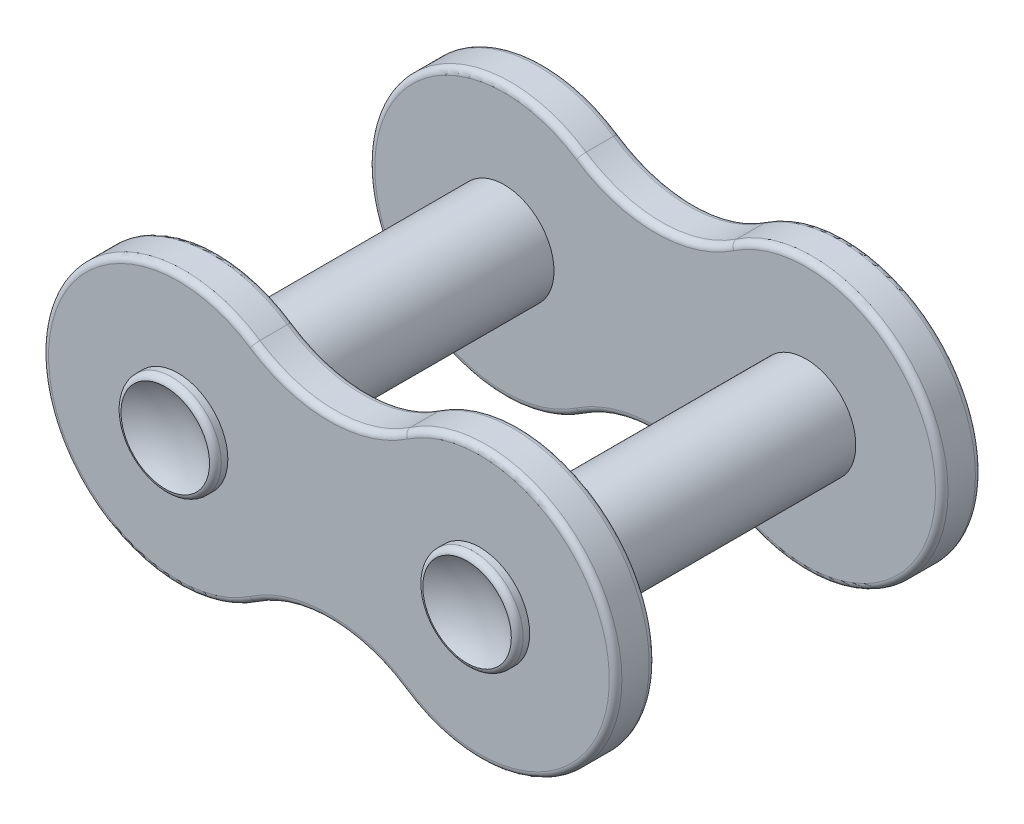
from build123d import *

# Parameters (mm, degrees)
SKETCH2_R           = 1.98
BOSS_EXTRUDE2_DEPTH = 1.5875
BOSS_EXTRUDE3_START = -0.508
SKETCH3_R           = 1.98
BOSS_EXTRUDE3_DEPTH = 15.573248
FILLET1_R           = 0.25
FILLET2_R           = 0.25


with BuildPart() as part:
    # Sketch2 → Boss-Extrude2 (new body)
    with BuildSketch(Plane.XY):
        with BuildLine():
            ThreePointArc((-2.993133713, 4.482383449), (-11.3975, 0), (-2.993133713, -4.482383449))
            ThreePointArc((-2.993133713, -4.482383449), (0, -3.571446301), (2.993133713, -4.482383449))
            ThreePointArc((2.993133713, -4.482383449), (11.3975, 0), (2.993133713, 4.482383449))
            ThreePointArc((2.993133713, 4.482383449), (0, 3.571446301), (-2.993133713, 4.482383449))
        make_face()
        with Locations((-6, 0)):
            Circle(SKETCH2_R, mode=Mode.SUBTRACT)
        with Locations(Location((6, 0, 0), (0, 0, 180))):
            Circle(SKETCH2_R, mode=Mode.SUBTRACT)
    boss_extrude2 = extrude(amount=BOSS_EXTRUDE2_DEPTH)

    # Sketch3 → Boss-Extrude3 (add)
    with BuildSketch(Plane.XY.offset(BOSS_EXTRUDE3_START)):
        with Locations((-6, 0)):
            Circle(SKETCH3_R)
    boss_extrude3 = extrude(amount=BOSS_EXTRUDE3_DEPTH)

    # Mirror1: Boss-Extrude2 across plane
    add(boss_extrude2.mirror(Plane(origin=(0, 0, 7.278624), x_dir=(1, 0, 0), z_dir=(0, 0, -1))))

    # Sketch5 → Cut-Revolve1 (revolve, cut)
    with BuildSketch(Plane(origin=(0, 0, 0), x_dir=(1, 0, 0), z_dir=(0, 1, 0)), mode=Mode.PRIVATE) as cut_revolve1_sk:
        with BuildLine():
            Line((-6, -15.319248), (-8.109882461, -15.319248))
            ThreePointArc((-8.109882461, -15.319248), (-7.12163363, -14.753585108), (-6, -14.557248))
            Line((-6, -14.557248), (-6, -15.319248))
        make_face()
    cut_revolve1 = revolve(cut_revolve1_sk.sketch.rotate(Axis((-6, 0, 14.557248), (0, 0, 1)), 180), axis=Axis((-6, 0, 14.557248), (0, 0, 1)), mode=Mode.SUBTRACT)

    # Mirror2: Cut-Revolve1 across plane
    add(cut_revolve1.mirror(Plane(origin=(0, 0, 7.278624), x_dir=(1, 0, 0), z_dir=(0, 0, -1))), mode=Mode.SUBTRACT)

    # Mirror3: Boss-Extrude3, Cut-Revolve1 across plane
    add(boss_extrude3.mirror(Plane(origin=(0, 0, 0), x_dir=(0, 0, 1), z_dir=(1, 0, 0))))
    add(cut_revolve1.mirror(Plane(origin=(0, 0, 0), x_dir=(0, 0, 1), z_dir=(1, 0, 0))), mode=Mode.SUBTRACT)

    # Mirror3 copy 1 sketch → Mirror3 copy 1 (revolve, cut)
    with BuildSketch(Plane(origin=(0, 0, 14.557248), x_dir=(-1, 0, 0), z_dir=(0, 1, 0))):
        with BuildLine():
            Line((-6, -15.319248), (-8.109882461, -15.319248))
            ThreePointArc((-8.109882461, -15.319248), (-7.12163363, -14.753585108), (-6, -14.557248))
            Line((-6, -14.557248), (-6, -15.319248))
        make_face()
    revolve(axis=Axis((6, 0, 0), (0, 0, -1)), mode=Mode.SUBTRACT)

    # Fillet1
    fillet1_edges = [part.edges().sort_by_distance(p)[0] for p in [
        (0, -3.571446301, 1.5875),
        (11.3975, 0, 1.5875),
        (0, 3.571446301, 12.969748),
        (11.3975, 0, 12.969748),
        (0, -3.571446301, 12.969748),
        (-11.3975, 0, 12.969748),
        (0, 3.571446301, 14.557248),
        (-11.3975, 0, 14.557248),
        (0, -3.571446301, 14.557248),
        (11.3975, 0, 14.557248),
        (0, 3.571446301, 1.5875),
        (11.3975, 0, 0),
        (0, -3.571446301, 0),
        (-11.3975, 0, 0),
        (0, 3.571446301, 0),
        (-11.3975, 0, 1.5875),
    ]]
    fillet(fillet1_edges, radius=FILLET1_R)

    # Fillet2
    # the kernel refuses this fillet: 0.25 mm, written as the material it takes off along each edge
    with BuildSketch(Plane(origin=(-6, 0, -0.508), x_dir=(1, 0, 0), z_dir=(0, -1, 0))) as fillet2_piece_1:
        with BuildLine():
            CenterArc((1.73, 0.248221931), FILLET2_R, 276.837537201, 83.162462799)
            Line((1.75976362, 0), (1.760358893, -0.004964439))
            ThreePointArc((1.760358893, -0.004964439), (1.86988181, -0.005), (1.98, -0.005))
            Line((1.98, -0.005), (1.985, 0))
            Line((1.985, 0), (1.985, 0.248221931))
            Line((1.985, 0.248221931), (1.98, 0.248221931))
        make_face()
    revolve(axis=Axis((-6, 0, -0.508), (0, 0, 1)), mode=Mode.SUBTRACT)
    with BuildSketch(Plane(origin=(-6, 0, 15.065248), x_dir=(1, 0, 0), z_dir=(0, -1, 0))) as fillet2_piece_2:
        with BuildLine():
            CenterArc((1.73, -0.248221931), FILLET2_R, 0, 83.162462799)
            Line((1.75976362, 0), (1.760358893, 0.004964439))
            ThreePointArc((1.760358893, 0.004964439), (1.86988181, 0.005), (1.98, 0.005))
            Line((1.98, 0.005), (1.985, 0))
            Line((1.985, 0), (1.985, -0.248221931))
            Line((1.985, -0.248221931), (1.98, -0.248221931))
        make_face()
    revolve(axis=Axis((-6, 0, 15.065248), (0, 0, 1)), mode=Mode.SUBTRACT)
    with BuildSketch(Plane(origin=(6, 0, 15.065248), x_dir=(-1, 0, 0), z_dir=(0, -1, 0))) as fillet2_piece_3:
        with BuildLine():
            CenterArc((1.73, 0.248221931), FILLET2_R, 276.837537201, 83.162462799)
            Line((1.75976362, 0), (1.760358893, -0.004964439))
            ThreePointArc((1.760358893, -0.004964439), (1.86988181, -0.005), (1.98, -0.005))
            Line((1.98, -0.005), (1.985, 0))
            Line((1.985, 0), (1.985, 0.248221931))
            Line((1.985, 0.248221931), (1.98, 0.248221931))
        make_face()
    revolve(axis=Axis((6, 0, 15.065248), (0, 0, -1)), mode=Mode.SUBTRACT)
    with BuildSketch(Plane(origin=(6, 0, -0.508), x_dir=(-1, 0, 0), z_dir=(0, -1, 0))) as fillet2_piece_4:
        with BuildLine():
            CenterArc((1.73, -0.248221931), FILLET2_R, 0, 83.162462799)
            Line((1.75976362, 0), (1.760358893, 0.004964439))
            ThreePointArc((1.760358893, 0.004964439), (1.86988181, 0.005), (1.98, 0.005))
            Line((1.98, 0.005), (1.985, 0))
            Line((1.985, 0), (1.985, -0.248221931))
            Line((1.985, -0.248221931), (1.98, -0.248221931))
        make_face()
    revolve(axis=Axis((6, 0, -0.508), (0, 0, -1)), mode=Mode.SUBTRACT)


solid = part.part
